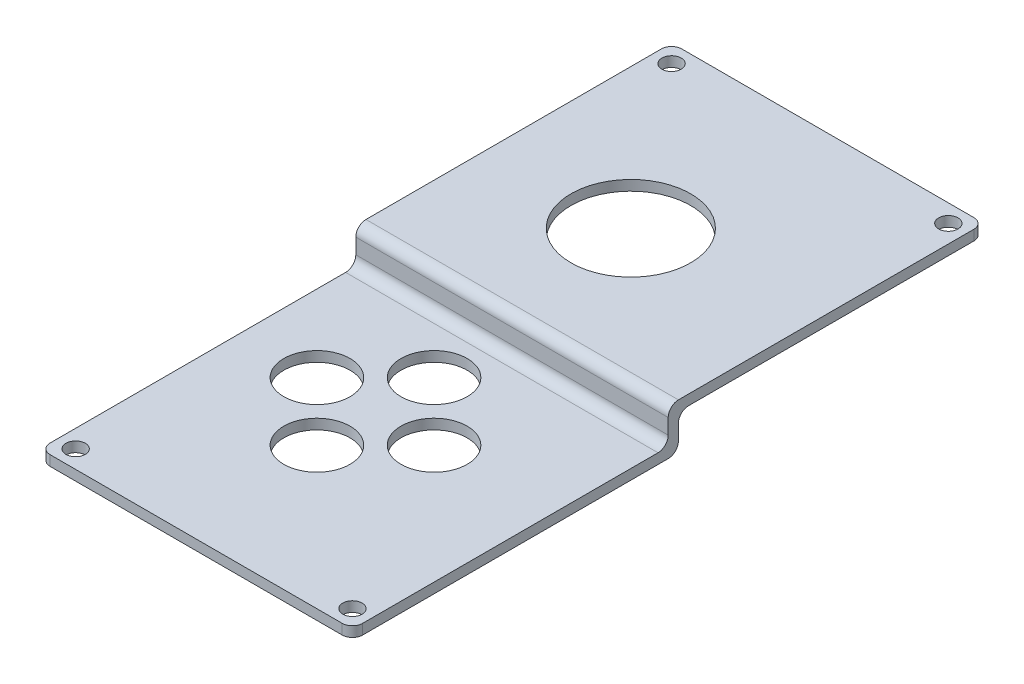
from build123d import *

# Parameters (mm, degrees)
BOSS_EXTRUDE1_DEPTH = 61.34
SKETCH3_R           = 11.75
SKETCH3_R_2         = 1.9
CUT_EXTRUDE1_DEPTH  = 90.104408421
SKETCH4_R           = 6.5
SKETCH4_R_2         = 1.9
CUT_EXTRUDE2_DEPTH  = 89.924662496
FILLET1_R           = 2
FILLET3_R           = 2


with BuildPart() as part:
    # Sketch2 → Boss-Extrude1 (new body)
    with BuildSketch(Plane(origin=(0, 0, 0), x_dir=(0, 0, -1), z_dir=(1, 0, 0))):
        Polygon((0, 0), (60, 0), (60, 2), (-2, 2), (-2, -5), (-64, -5), (-64, -7), (0, -7), align=None)
    extrude(amount=BOSS_EXTRUDE1_DEPTH)

    # Sketch3 → Cut-Extrude1 (cut, through all)
    with BuildSketch(Plane(origin=(0, 2, 0), x_dir=(1, 0, 0), z_dir=(0, 1, 0))):
        with Locations((27.5, 24.5)):
            Circle(SKETCH3_R)
        with Locations((57.84, 56.5)):
            Circle(SKETCH3_R_2)
        with Locations((3.5, 56.5)):
            Circle(SKETCH3_R_2)
    extrude(amount=-CUT_EXTRUDE1_DEPTH, mode=Mode.SUBTRACT)

    # Sketch4 → Cut-Extrude2 (cut, through all)
    with BuildSketch(Plane(origin=(0, -5, 0), x_dir=(1, 0, 0), z_dir=(0, 1, 0))):
        with Locations((38.07, -24.7)):
            Circle(SKETCH4_R)
        with Locations((26.57, -36.2)):
            Circle(SKETCH4_R)
        with Locations((15.07, -24.7)):
            Circle(SKETCH4_R)
        with Locations((26.57, -13.2)):
            Circle(SKETCH4_R)
        with Locations((57.84, -60.5)):
            Circle(SKETCH4_R_2)
        with Locations((3.5, -60.5)):
            Circle(SKETCH4_R_2)
    extrude(amount=-CUT_EXTRUDE2_DEPTH, mode=Mode.SUBTRACT)

    # Fillet1
    fillet1_edges = [part.edges().sort_by_distance(p)[0] for p in [
        (30.67, 0, 0),
        (30.67, -7, 0),
        (30.67, 2, 2),
        (30.67, -5, 2),
    ]]
    fillet(fillet1_edges, radius=FILLET1_R)

    # Fillet3
    fillet3_edges = [part.edges().sort_by_distance(p)[0] for p in [
        (61.34, 1, -60),
        (61.34, -6, 64),
        (0, -6, 64),
        (0, 1, -60),
    ]]
    fillet(fillet3_edges, radius=FILLET3_R)


solid = part.part
